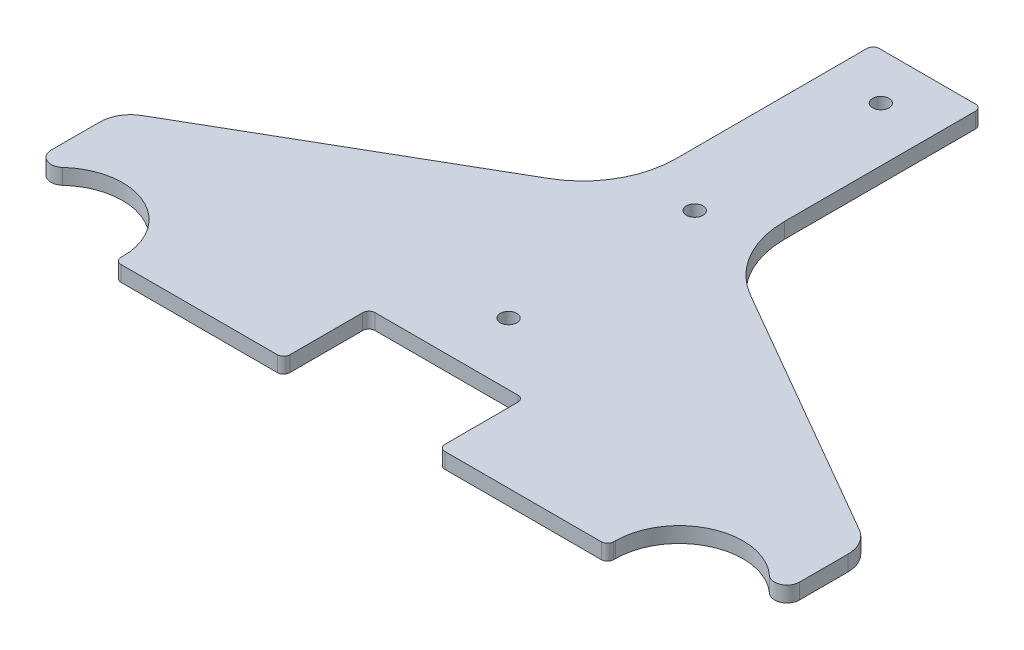
from build123d import *

# Parameters (mm, degrees)
BOSS_EXTRUDE1_DEPTH     = 6.35
SKETCH2_W               = 63.5
SKETCH2_H               = 34.925
CUT_EXTRUDE1_DEPTH      = 299.126542166
F_1_4_CLEARANCE_HOLE1_D = 6.7564
CUT_EXTRUDE2_DEPTH      = 299.126542166
FILLET1_R               = 25.4
FILLET2_R               = 5.08
FILLET3_R               = 2.54
CUT_EXTRUDE4_DEPTH      = 276.239678724
FILLET5_R               = 12.7
FILLET6_R               = 38.1


with BuildPart() as part:
    # Sketch1 → Boss-Extrude1 (new body)
    with BuildSketch(Plane(origin=(0, 0, 0), x_dir=(1, 0, 0), z_dir=(0, 1, 0))):
        with BuildLine():
            Line((22.225, 228.6), (-22.225, 228.6))
            Line((-22.225, 228.6), (-22.225, 190.5))
            ThreePointArc((-22.225, 190.5), (-25.761770597, 174.46899338), (-35.715455289, 161.414259351))
            Line((-35.715455289, 161.414259351), (-168.508098746, 49.057949228))
            ThreePointArc((-168.508098746, 49.057949228), (-185.296646926, 27.038964499), (-191.262, 0))
            Line((-191.262, 0), (-191.262, -3.175))
            Line((-191.262, -3.175), (-153.162, -3.175))
            Line((-153.162, -3.175), (-153.162, 0))
            ThreePointArc((-153.162, 0), (-127, 26.162), (-100.838, 0))
            Line((-100.838, 0), (-100.838, -3.175))
            Line((-100.838, -3.175), (100.838, -3.175))
            Line((100.838, -3.175), (100.838, 0))
            ThreePointArc((100.838, 0), (127, 26.162), (153.162, 0))
            Line((153.162, 0), (153.162, -3.175))
            Line((153.162, -3.175), (191.262, -3.175))
            Line((191.262, -3.175), (191.262, 0))
            ThreePointArc((191.262, 0), (185.296646926, 27.038964499), (168.508098746, 49.057949228))
            Line((168.508098746, 49.057949228), (35.715455289, 161.414259351))
            ThreePointArc((35.715455289, 161.414259351), (25.761770597, 174.46899338), (22.225, 190.5))
            Line((22.225, 190.5), (22.225, 228.6))
        make_face()
    extrude(amount=BOSS_EXTRUDE1_DEPTH)

    # Sketch2 → Cut-Extrude1 (cut, through all)
    with BuildSketch(Plane(origin=(0, 6.35, 0), x_dir=(1, 0, 0), z_dir=(0, 1, 0))):
        with Locations((0, 14.2875)):
            Rectangle(SKETCH2_W, SKETCH2_H)
    extrude(amount=-CUT_EXTRUDE1_DEPTH, mode=Mode.SUBTRACT)

    # 1/4 Clearance Hole1 (through all)
    with Locations(Plane(origin=(0, 6.35, 0), x_dir=(1, 0, 0), z_dir=(0, 1, 0))):
        with Locations((0, 209.55), (0, 133.35), (0, 57.15)):
            Hole(F_1_4_CLEARANCE_HOLE1_D / 2)

    # Sketch5 → Cut-Extrude2 (cut, through all)
    with BuildSketch(Plane(origin=(0, 6.35, 0), x_dir=(1, 0, 0), z_dir=(0, 1, 0))):
        with BuildLine():
            Line((-153.162, -3.175), (-153.162, 62.042335901))
            Line((-153.162, 62.042335901), (-168.508098746, 49.057949228))
            ThreePointArc((-168.508098746, 49.057949228), (-185.296646926, 27.038964499), (-191.262, 0))
            Line((-191.262, 0), (-191.262, -3.175))
            Line((-191.262, -3.175), (-153.162, -3.175))
        make_face()
        with BuildLine():
            Line((191.262, 0), (191.262, -3.175))
            Line((191.262, -3.175), (153.162, -3.175))
            Line((153.162, -3.175), (153.162, 62.042335901))
            Line((153.162, 62.042335901), (168.508098746, 49.057949228))
            ThreePointArc((168.508098746, 49.057949228), (185.296646926, 27.038964499), (191.262, 0))
        make_face()
    extrude(amount=-CUT_EXTRUDE2_DEPTH, mode=Mode.SUBTRACT)

    # Fillet1
    fillet1_edges = [part.edges().sort_by_distance(p)[0] for p in [
        (153.162, 3.175, -62.042335901),
        (-153.162, 3.175, -62.042335901),
    ]]
    fillet(fillet1_edges, radius=FILLET1_R)

    # Fillet2
    fillet2_edges = [part.edges().sort_by_distance(p)[0] for p in [
        (153.162, 3.175, 0),
        (-153.162, 3.175, 0),
    ]]
    fillet(fillet2_edges, radius=FILLET2_R)

    # Fillet3
    fillet3_edges = [part.edges().sort_by_distance(p)[0] for p in [
        (100.838, 3.175, 3.175),
        (-100.838, 3.175, 3.175),
        (22.225, 3.175, -228.6),
        (-22.225, 3.175, -228.6),
        (31.75, 3.175, 3.175),
        (31.75, 3.175, -31.75),
        (-31.75, 3.175, -31.75),
        (-31.75, 3.175, 3.175),
    ]]
    fillet(fillet3_edges, radius=FILLET3_R)

    # Sketch7 → Cut-Extrude4 (cut, through all)
    with BuildSketch(Plane(origin=(0, 6.35, 0), x_dir=(1, 0, 0), z_dir=(0, 1, 0))):
        Polygon((-22.225, 125.857901259), (-153.162, 50.261389063), (-153.162, 60.856337773), (-22.225, 190.5), align=None)
        Polygon((153.162, 60.856337773), (153.162, 50.261389063), (22.225, 125.857901259), (22.225, 190.5), align=None)
    extrude(amount=-CUT_EXTRUDE4_DEPTH, mode=Mode.SUBTRACT)

    # Fillet5
    fillet5_edges = [part.edges().sort_by_distance(p)[0] for p in [
        (153.162, 3.175, -50.261389063),
        (-153.162, 3.175, -50.261389063),
    ]]
    fillet(fillet5_edges, radius=FILLET5_R)

    # Fillet6
    fillet6_edges = [part.edges().sort_by_distance(p)[0] for p in [
        (22.225, 3.175, -125.857901259),
        (-22.225, 3.175, -125.857901259),
    ]]
    fillet(fillet6_edges, radius=FILLET6_R)


solid = part.part
